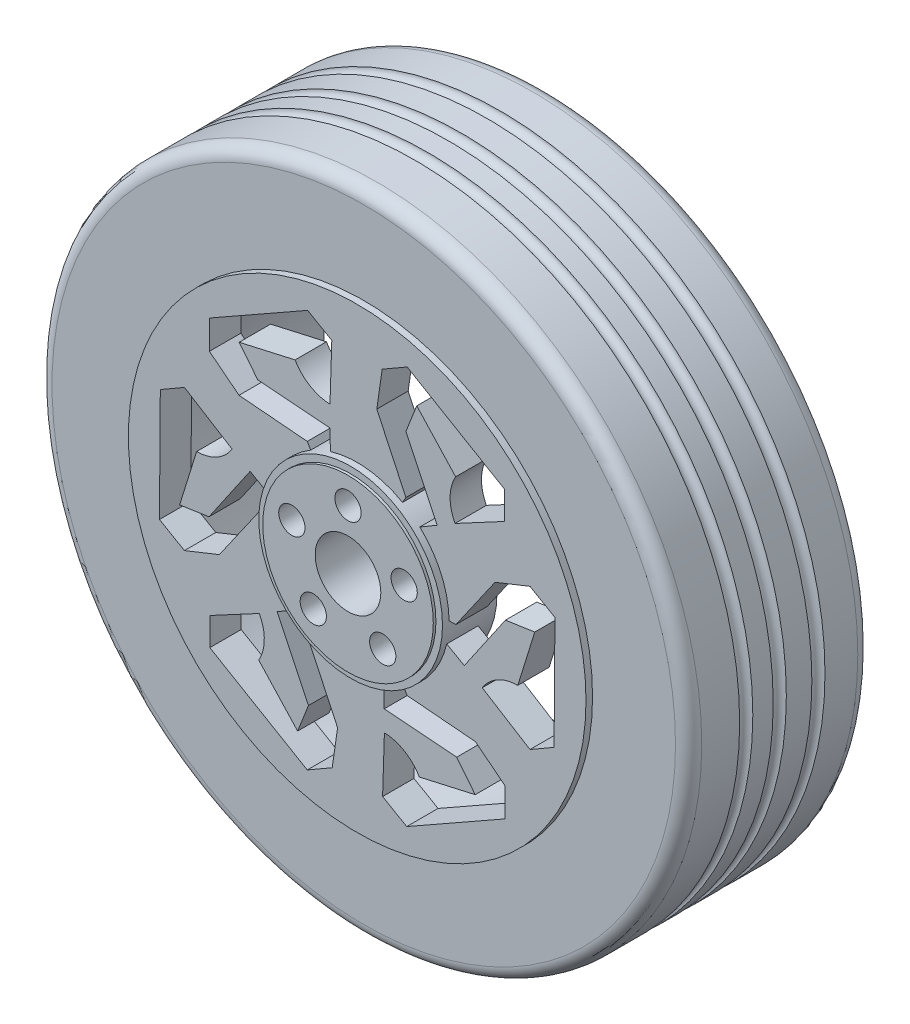
from build123d import *

# Parameters (mm, degrees)
SKETCH2_R                = 247.55
BOSS_EXTRUDE1_DEPTH      = 138.9
FILLET1_R                = 10
FILLET2_R                = 10
SKETCH3_R                = 174.35
BOSS_EXTRUDE2_DEPTH      = 5
CUT_EXTRUDE1_DEPTH       = 30
CUT_SWEEP1_PROFILE_R     = 5
CUT_SWEEP2_PROFILE_R     = 5
CUT_SWEEP3_PROFILE_R     = 5
F_3DSKETCH4_R            = 25
CUT_EXTRUDE2_DEPTH       = 179
SKETCH23_R               = 169.35
CUT_EXTRUDE4_DEPTH       = 120
BOSS_EXTRUDE6_DEPTH      = 5
BOSS_EXTRUDE6_DEPTH_BACK = 36.503
SKETCH113_R              = 70
SKETCH114_R              = 65
BOSS_EXTRUDE7_DEPTH      = 2
SKETCH115_R              = 25
CUT_EXTRUDE6_DEPTH       = 61
SKETCH116_R              = 10
CUT_EXTRUDE7_DEPTH       = 20
SKETCH117_R              = 5
CUT_EXTRUDE8_DEPTH       = 30


with BuildPart() as part:
    # Sketch2 → Boss-Extrude1 (new body)
    with BuildSketch(Plane.XY):
        Circle(SKETCH2_R)
    extrude(amount=BOSS_EXTRUDE1_DEPTH)

    # Fillet1
    fillet1_edges = [part.edges().sort_by_distance(p)[0] for p in [
        (-247.55, 0, 138.9),
    ]]
    fillet(fillet1_edges, radius=FILLET1_R)

    # Fillet2
    fillet2_edges = [part.edges().sort_by_distance(p)[0] for p in [
        (-247.55, 0, 0),
    ]]
    fillet(fillet2_edges, radius=FILLET2_R)

    # Sketch3 → Boss-Extrude2 (add)
    with BuildSketch(Plane.XY.offset(138.9)):
        Circle(SKETCH3_R)
    extrude(amount=BOSS_EXTRUDE2_DEPTH)

    # Sketch5 → Cut-Extrude1 (cut)
    with BuildSketch(Plane.XY.offset(143.9)):
        with BuildLine():
            Line((105.003706731, 43.369407929), (131.633696581, 54.021395774))
            Line((131.633696581, 54.021395774), (150.665269372, 43.031925067))
            Line((150.665269372, 43.031925067), (150.344554361, -0.360940867))
            Line((150.344554361, -0.360940867), (150.02910614, -43.041207894))
            Line((150.02910614, -43.041207894), (131.640430833, -53.657914533))
            Line((131.640430833, -53.657914533), (95.29019948, -31.084252667))
            ThreePointArc((95.29019948, -31.084252667), (106.873400183, -20.029907867), (122.363240346, -15.976029572))
            Line((122.363240346, -15.976029572), (135.299603851, 25.697677813))
            Line((135.299603851, 25.697677813), (112.925565246, 22.34468352))
            Line((112.925565246, 22.34468352), (81.592210025, -23.310129617))
            Line((81.592210025, -23.310129617), (40.25767623, 0.148769441))
            Line((40.25767623, 0.148769441), (75.177682959, 0.55093352))
            Line((75.177682959, 0.55093352), (105.003706731, 43.369407929))
        make_face()
        with BuildLine():
            Line((90.060862379, -69.251173556), (112.600749379, -86.987427346))
            Line((112.600749379, -86.987427346), (112.599374968, -108.963988211))
            Line((112.599374968, -108.963988211), (74.859693221, -130.38267383))
            Line((74.859693221, -130.38267383), (37.739773625, -151.449621172))
            Line((37.739773625, -151.449621172), (19.351098317, -140.832914533))
            Line((19.351098317, -140.832914533), (20.725347273, -98.065859815))
            ThreePointArc((20.725347273, -98.065859815), (36.090291044, -102.570033481), (47.345972712, -113.957689415))
            Line((47.345972712, -113.957689415), (89.90464373, -104.32405515))
            Line((89.90464373, -104.32405515), (75.813846191, -86.62406648))
            Line((75.813846191, -86.62406648), (20.608940598, -82.315991441))
            Line((20.608940598, -82.315991441), (20.25767623, -34.789785592))
            Line((20.25767623, -34.789785592), (38.065963903, -64.83031648))
            Line((38.065963903, -64.83031648), (90.060862379, -69.251173556))
        make_face()
        with BuildLine():
            Line((19.032947202, 141.008823121), (38.065894405, 151.995913278))
            Line((38.065894405, 151.995913278), (75.48486114, 130.021732964))
            Line((75.48486114, 130.021732964), (112.289332516, 108.408413278))
            Line((112.289332516, 108.408413278), (112.289332516, 87.175))
            Line((112.289332516, 87.175), (74.564852207, 66.981607148))
            ThreePointArc((74.564852207, 66.981607148), (70.78310914, 82.540125614), (75.017267633, 97.981659843))
            Line((75.017267633, 97.981659843), (45.394960121, 130.021732964))
            Line((45.394960121, 130.021732964), (37.111719056, 108.96875))
            Line((37.111719056, 108.96875), (60.983269426, 59.005861824))
            Line((60.983269426, 59.005861824), (20, 34.938555033))
            Line((20, 34.938555033), (37.111719056, 65.38125))
            Line((37.111719056, 65.38125), (14.942844352, 112.620581485))
            Line((14.942844352, 112.620581485), (19.032947202, 141.008823121))
        make_face()
        with BuildLine():
            Line((-14.942844352, -112.620581485), (-19.032947202, -141.008823121))
            Line((-19.032947202, -141.008823121), (-38.065894405, -151.995913278))
            Line((-38.065894405, -151.995913278), (-75.48486114, -130.021732964))
            Line((-75.48486114, -130.021732964), (-112.289332516, -108.408413278))
            Line((-112.289332516, -108.408413278), (-112.289332516, -87.175))
            Line((-112.289332516, -87.175), (-74.564852207, -66.981607148))
            ThreePointArc((-74.564852207, -66.981607148), (-70.78310914, -82.540125614), (-75.017267633, -97.981659843))
            Line((-75.017267633, -97.981659843), (-45.394960121, -130.021732964))
            Line((-45.394960121, -130.021732964), (-37.111719056, -108.96875))
            Line((-37.111719056, -108.96875), (-60.983269426, -59.005861824))
            Line((-60.983269426, -59.005861824), (-20, -34.938555033))
            Line((-20, -34.938555033), (-37.111719056, -65.38125))
            Line((-37.111719056, -65.38125), (-14.942844352, -112.620581485))
        make_face()
        with BuildLine():
            Line((-105.003706731, -43.369407929), (-131.633696581, -54.021395774))
            Line((-131.633696581, -54.021395774), (-150.665269372, -43.031925067))
            Line((-150.665269372, -43.031925067), (-150.344554361, 0.360940867))
            Line((-150.344554361, 0.360940867), (-150.02910614, 43.041207894))
            Line((-150.02910614, 43.041207894), (-131.640430833, 53.657914533))
            Line((-131.640430833, 53.657914533), (-95.29019948, 31.084252667))
            ThreePointArc((-95.29019948, 31.084252667), (-106.873400183, 20.029907867), (-122.363240346, 15.976029572))
            Line((-122.363240346, 15.976029572), (-135.299603851, -25.697677813))
            Line((-135.299603851, -25.697677813), (-112.925565246, -22.34468352))
            Line((-112.925565246, -22.34468352), (-81.592210025, 23.310129617))
            Line((-81.592210025, 23.310129617), (-40.25767623, -0.148769441))
            Line((-40.25767623, -0.148769441), (-75.177682959, -0.55093352))
            Line((-75.177682959, -0.55093352), (-105.003706731, -43.369407929))
        make_face()
        with BuildLine():
            Line((-90.060862379, 69.251173556), (-112.600749379, 86.987427346))
            Line((-112.600749379, 86.987427346), (-112.599374968, 108.963988211))
            Line((-112.599374968, 108.963988211), (-74.859693221, 130.38267383))
            Line((-74.859693221, 130.38267383), (-37.739773625, 151.449621172))
            Line((-37.739773625, 151.449621172), (-19.351098317, 140.832914533))
            Line((-19.351098317, 140.832914533), (-20.725347273, 98.065859815))
            ThreePointArc((-20.725347273, 98.065859815), (-36.090291044, 102.570033481), (-47.345972712, 113.957689415))
            Line((-47.345972712, 113.957689415), (-89.90464373, 104.32405515))
            Line((-89.90464373, 104.32405515), (-75.813846191, 86.62406648))
            Line((-75.813846191, 86.62406648), (-20.608940598, 82.315991441))
            Line((-20.608940598, 82.315991441), (-20.25767623, 34.789785592))
            Line((-20.25767623, 34.789785592), (-38.065963903, 64.83031648))
            Line((-38.065963903, 64.83031648), (-90.060862379, 69.251173556))
        make_face()
    extrude(amount=-CUT_EXTRUDE1_DEPTH, mode=Mode.SUBTRACT)

    # Cut-Sweep1: sweep along a path in Sketch16
    with BuildLine(Plane.XY.offset(40)) as cut_sweep1_path:
        CenterArc((0, 0), 247.55, 0, 360)
    # Cut-Sweep1 profile (on start of the path) → Cut-Sweep1 (sweep, cut)
    with BuildSketch(Plane(origin=(247.55, 0, 40), x_dir=(0, 0, 1), z_dir=(0, 1, 0))):
        Circle(CUT_SWEEP1_PROFILE_R)
    sweep(path=cut_sweep1_path.line, mode=Mode.SUBTRACT)

    # Cut-Sweep2: sweep along a path in Sketch15
    with BuildLine(Plane.XY.offset(69.45)) as cut_sweep2_path:
        CenterArc((0, 0), 247.55, 0, 360)
    # Cut-Sweep2 profile (on start of the path) → Cut-Sweep2 (sweep, cut)
    with BuildSketch(Plane(origin=(247.55, 0, 69.45), x_dir=(0, 0, 1), z_dir=(0, 1, 0))):
        Circle(CUT_SWEEP2_PROFILE_R)
    sweep(path=cut_sweep2_path.line, mode=Mode.SUBTRACT)

    # Cut-Sweep3: sweep along a path in Sketch14
    with BuildLine(Plane.XY.offset(95)) as cut_sweep3_path:
        CenterArc((0, 0), 247.55, 0, 360)
    # Cut-Sweep3 profile (on start of the path) → Cut-Sweep3 (sweep, cut)
    with BuildSketch(Plane(origin=(247.55, 0, 95), x_dir=(0, 0, 1), z_dir=(0, 1, 0))):
        Circle(CUT_SWEEP3_PROFILE_R)
    sweep(path=cut_sweep3_path.line, mode=Mode.SUBTRACT)

    # 3DSketch4 → Cut-Extrude2 (cut)
    with BuildSketch(Plane.XY):
        Circle(F_3DSKETCH4_R)
    extrude(amount=CUT_EXTRUDE2_DEPTH, mode=Mode.SUBTRACT)

    # Sketch23 → Cut-Extrude4 (cut)
    with BuildSketch(Plane(origin=(0, 0, 0), x_dir=(-1, 0, 0), z_dir=(0, 0, -1))):
        Circle(SKETCH23_R)
    extrude(amount=-CUT_EXTRUDE4_DEPTH, mode=Mode.SUBTRACT)

    # Sketch113 → Boss-Extrude6 (add, two sides: drawn at the far end of the back side and taken through both)
    with BuildSketch(Plane.XY.offset(143.9).offset(-BOSS_EXTRUDE6_DEPTH_BACK)):
        Circle(SKETCH113_R)
    extrude(amount=BOSS_EXTRUDE6_DEPTH + BOSS_EXTRUDE6_DEPTH_BACK)

    # Sketch114 → Boss-Extrude7 (add)
    with BuildSketch(Plane.XY.offset(148.9)):
        Circle(SKETCH114_R)
    extrude(amount=BOSS_EXTRUDE7_DEPTH)

    # Sketch115 → Cut-Extrude6 (cut)
    with BuildSketch(Plane.XY.offset(150.9)):
        Circle(SKETCH115_R)
    extrude(amount=-CUT_EXTRUDE6_DEPTH, mode=Mode.SUBTRACT)

    # Sketch116 → Cut-Extrude7 (cut)
    with BuildSketch(Plane.XY.offset(150.9)):
        with Locations((0, 45)):
            Circle(SKETCH116_R)
        with Locations((42.797543233, 13.905764747)):
            Circle(SKETCH116_R)
        with Locations((26.450336353, -36.405764747)):
            Circle(SKETCH116_R)
        with Locations((-26.450336353, -36.405764747)):
            Circle(SKETCH116_R)
        with Locations((-42.797543233, 13.905764747)):
            Circle(SKETCH116_R)
    extrude(amount=-CUT_EXTRUDE7_DEPTH, mode=Mode.SUBTRACT)

    # Sketch117 → Cut-Extrude8 (cut)
    with BuildSketch(Plane.XY.offset(130.9)):
        with Locations((0, 45)):
            Circle(SKETCH117_R)
        with Locations((42.797543233, 13.905764747)):
            Circle(SKETCH117_R)
        with Locations((26.450336353, -36.405764747)):
            Circle(SKETCH117_R)
        with Locations((-26.450336353, -36.405764747)):
            Circle(SKETCH117_R)
        with Locations((-42.797543233, 13.905764747)):
            Circle(SKETCH117_R)
    extrude(amount=-CUT_EXTRUDE8_DEPTH, mode=Mode.SUBTRACT)


solid = part.part
